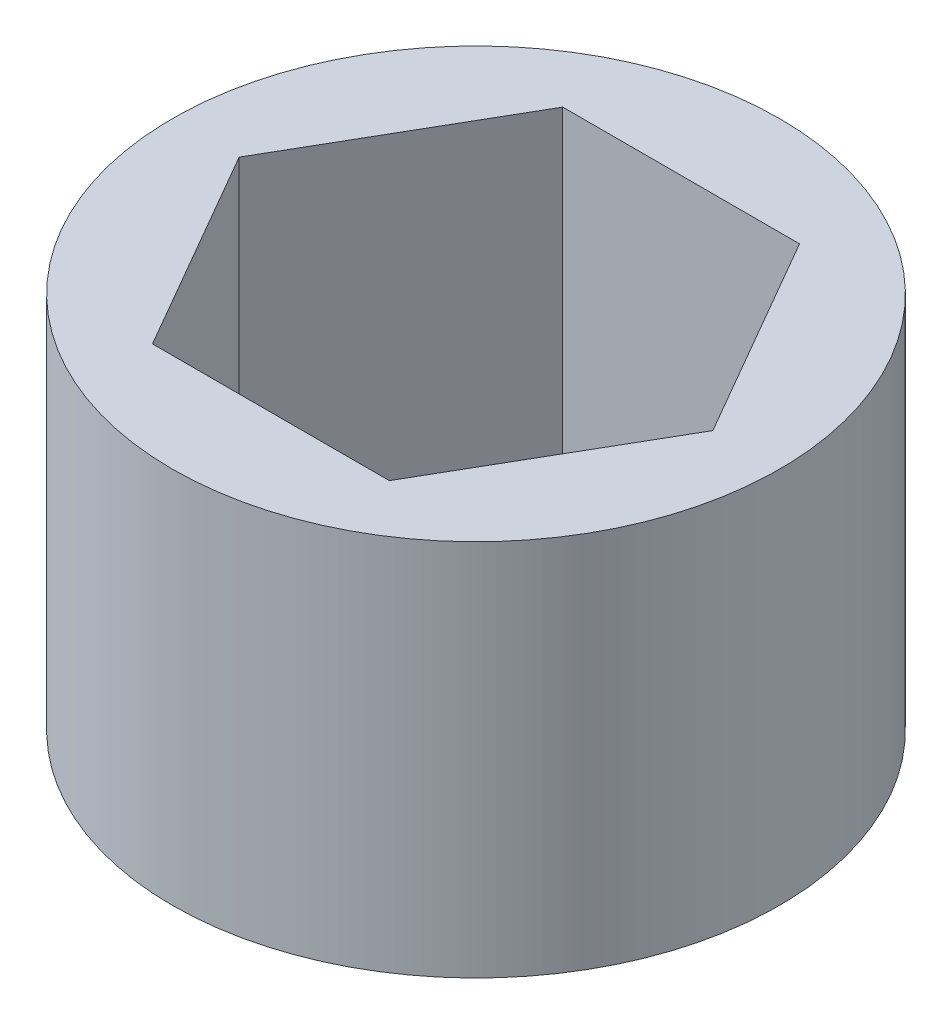
from build123d import *

# Parameters (mm, degrees)
SKETCH1_R           = 7.14375
BOSS_EXTRUDE1_DEPTH = 4.445


with BuildPart() as part:
    # Sketch1 → Boss-Extrude1 (new, symmetric)
    with BuildSketch(Plane(origin=(0, 0, 0), x_dir=(1, 0, 0), z_dir=(0, 1, 0))):
        Circle(SKETCH1_R)
        Polygon((2.786292399, -4.826), (5.572584798, 0), (2.786292399, 4.826), (-2.786292399, 4.826), (-5.572584798, 0), (-2.786292399, -4.826), align=None, mode=Mode.SUBTRACT)
    extrude(amount=BOSS_EXTRUDE1_DEPTH, both=True)


solid = part.part
